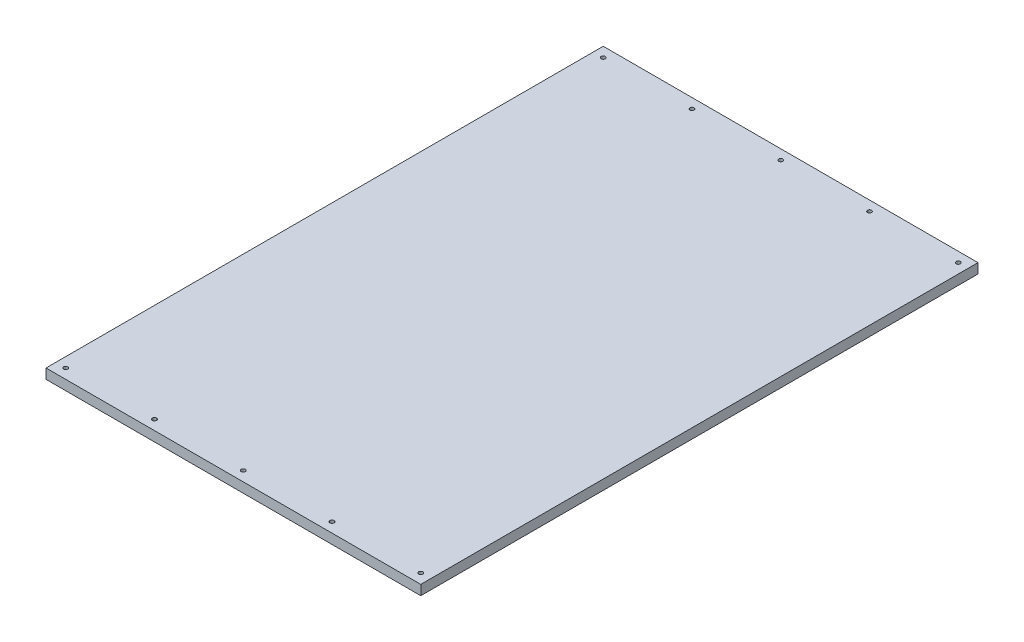
from build123d import *

# Parameters (mm, degrees)
SKETCH1_W           = 380
SKETCH1_H           = 565
BOSS_EXTRUDE1_DEPTH = 10
SKETCH2_R           = 2.1
CUT_EXTRUDE1_DEPTH  = 10


with BuildPart() as part:
    # Sketch1 → Boss-Extrude1 (new body)
    with BuildSketch(Plane(origin=(0, 0, 0), x_dir=(1, 0, 0), z_dir=(0, 1, 0))):
        Rectangle(SKETCH1_W, SKETCH1_H)
    extrude(amount=BOSS_EXTRUDE1_DEPTH)

    # Sketch2 → Cut-Extrude1 (cut)
    with BuildSketch(Plane(origin=(0, 10, 0), x_dir=(1, 0, 0), z_dir=(0, 1, 0))):
        with Locations((0, 272.5)):
            Circle(SKETCH2_R)
        with Locations((90, 272.5)):
            Circle(SKETCH2_R)
        with Locations((180, 272.5)):
            Circle(SKETCH2_R)
        with Locations((-90, 272.5)):
            Circle(SKETCH2_R)
        with Locations((-180, 272.5)):
            Circle(SKETCH2_R)
        with Locations((180, -272.5)):
            Circle(SKETCH2_R)
        with Locations((90, -272.5)):
            Circle(SKETCH2_R)
        with Locations((0, -272.5)):
            Circle(SKETCH2_R)
        with Locations((-90, -272.5)):
            Circle(SKETCH2_R)
        with Locations((-180, -272.5)):
            Circle(SKETCH2_R)
    extrude(amount=-CUT_EXTRUDE1_DEPTH, mode=Mode.SUBTRACT)


solid = part.part
